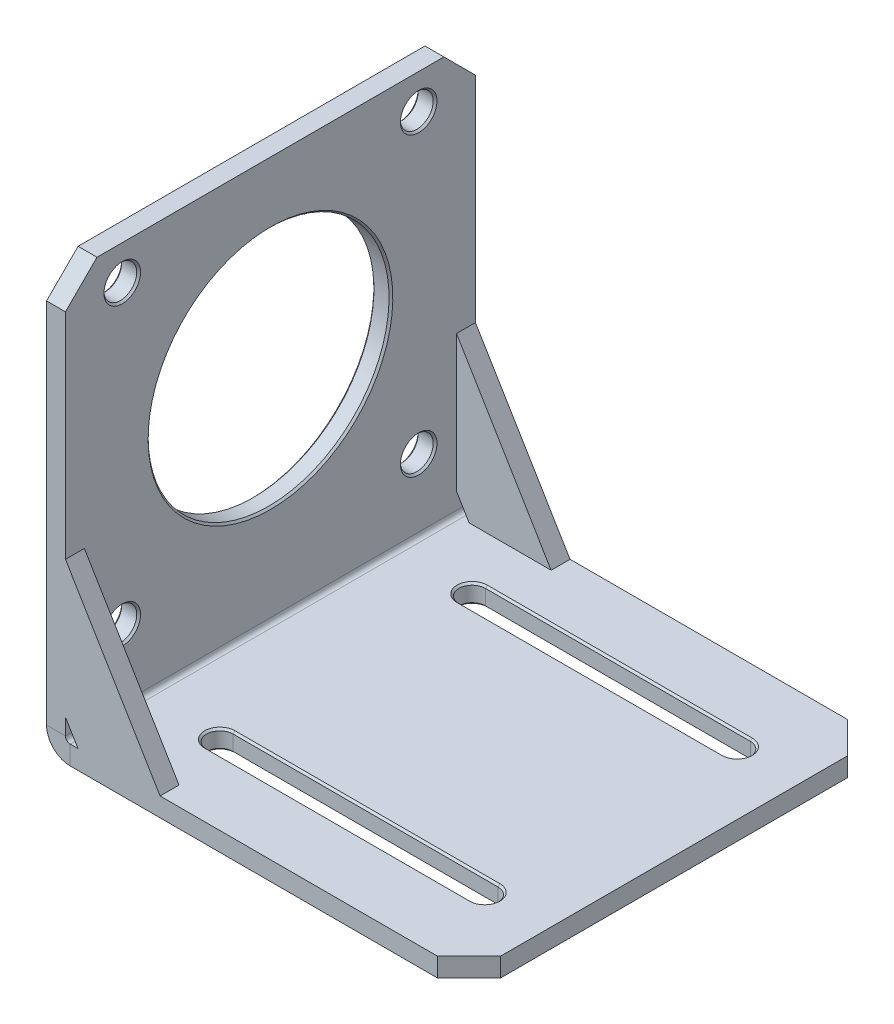
from build123d import *

# Parameters (mm, degrees)
SKETCH1_W                    = 130
SKETCH1_H                    = 65
BASE_FLANGE1_DEPTH           = 3
SKETCH2_R                    = 19.1
SKETCH2_R_2                  = 2.6
CUT_EXTRUDE1_DEPTH           = 135.034510481
CUT_EXTRUDE3_DEPTH           = 135.034510481
SKETCHED_BEND2_OUTLINE_W     = 3
SKETCHED_BEND2_OUTLINE_H     = 65
SKETCHED_BEND2_DEPTH         = 63.020021532
SKETCHED_START               = 63.383443248
SKETCHED_BEND2_2_OUTLINE_W   = 63.979978468
SKETCHED_BEND2_2_OUTLINE_H   = 65
SKETCHED_BEND2_2_OUTLINE_R   = 2.6
SKETCHED_BEND2_2_OUTLINE_R_2 = 19.1
SKETCHED_BEND2_2_DEPTH       = 2.636578284
SKETCHED_START_2             = 63.020021532
SKETCHED_BEND2_3_OUTLINE_W   = 63.979978468
SKETCHED_BEND2_3_OUTLINE_H   = 65
SKETCHED_BEND2_3_OUTLINE_R   = 2.6
SKETCHED_BEND2_3_OUTLINE_R_2 = 19.1
SKETCHED_BEND2_3_DEPTH       = 3.7366
SKETCHED_START_3             = -33
SKETCHED_BEND2_4_DEPTH       = 66
BOSS_EXTRUDE1_DEPTH          = 3
CHAMFER1_SIZE                = 5
CHAMFER2_SIZE                = 0.3


with BuildPart() as part:
    # Base-Flange1: sheet metal written as solids
    # Sketch1 → Base-Flange1 (new body)
    with BuildSketch(Plane(origin=(0, 0, 0), x_dir=(1, 0, 0), z_dir=(0, 1, 0))):
        with Locations((65, 0)):
            Rectangle(SKETCH1_W, SKETCH1_H)
    extrude(amount=-BASE_FLANGE1_DEPTH)

    # Sketch2 → Cut-Extrude1 (cut, through all)
    with BuildSketch(Plane(origin=(0, 0, 0), x_dir=(1, 0, 0), z_dir=(0, 1, 0))):
        with Locations(Location((29, 0, 0), (0, 0, 270))):
            Circle(SKETCH2_R)
        with Locations(Location((5.5, 23.5, 0), (0, 0, 270))):
            Circle(SKETCH2_R_2)
        with Locations(Location((52.5, 23.5, 0), (0, 0, 270))):
            Circle(SKETCH2_R_2)
        with Locations(Location((52.5, -23.5, 0), (0, 0, 270))):
            Circle(SKETCH2_R_2)
        with Locations(Location((5.5, -23.5, 0), (0, 0, 270))):
            Circle(SKETCH2_R_2)
    extrude(amount=-CUT_EXTRUDE1_DEPTH, mode=Mode.SUBTRACT)

    # Sketch4 → Cut-Extrude3 (cut, through all)
    with BuildSketch(Plane(origin=(0, 0, 0), x_dir=(1, 0, 0), z_dir=(0, 1, 0))):
        with BuildLine():
            Line((78, 22.1), (120, 22.1))
            ThreePointArc((120, 22.1), (122.1, 20), (120, 17.9))
            Line((120, 17.9), (78, 17.9))
            ThreePointArc((78, 17.9), (75.9, 20), (78, 22.1))
        make_face()
        with BuildLine():
            Line((78, -17.9), (120, -17.9))
            ThreePointArc((120, -17.9), (122.1, -20), (120, -22.1))
            Line((120, -22.1), (78, -22.1))
            ThreePointArc((78, -22.1), (75.9, -20), (78, -17.9))
        make_face()
    extrude(amount=-CUT_EXTRUDE3_DEPTH, mode=Mode.SUBTRACT)

    # Sketched Bend2: read off the stored shape, not the designer's step
    # Sketched Bend2 outline → Sketched Bend2 (cut)
    with BuildSketch(Plane.YZ):
        with Locations((-1.5, 0)):
            Rectangle(SKETCHED_BEND2_OUTLINE_W, SKETCHED_BEND2_OUTLINE_H)
    extrude(amount=SKETCHED_BEND2_DEPTH, mode=Mode.SUBTRACT)

    # Sketched Bend2 2 outline → Sketched Bend2 2 (add)
    with BuildSketch(Plane.YZ.offset(SKETCHED_START)):
        with Locations((31.989989234, 0)):
            Rectangle(SKETCHED_BEND2_2_OUTLINE_W, SKETCHED_BEND2_2_OUTLINE_H)
        with Locations((11.479978468, -23.5)):
            Circle(SKETCHED_BEND2_2_OUTLINE_R, mode=Mode.SUBTRACT)
        with Locations((58.479978468, -23.5)):
            Circle(SKETCHED_BEND2_2_OUTLINE_R, mode=Mode.SUBTRACT)
        with Locations((11.479978468, 23.5)):
            Circle(SKETCHED_BEND2_2_OUTLINE_R, mode=Mode.SUBTRACT)
        with Locations((34.979978468, 0)):
            Circle(SKETCHED_BEND2_2_OUTLINE_R_2, mode=Mode.SUBTRACT)
        with Locations((58.479978468, 23.5)):
            Circle(SKETCHED_BEND2_2_OUTLINE_R, mode=Mode.SUBTRACT)
    extrude(amount=SKETCHED_BEND2_2_DEPTH)

    # Sketched Bend2 3 outline → Sketched Bend2 3 (add)
    with BuildSketch(Plane.YZ.offset(SKETCHED_START_2)):
        with Locations((31.989989234, 0)):
            Rectangle(SKETCHED_BEND2_3_OUTLINE_W, SKETCHED_BEND2_3_OUTLINE_H)
        with Locations((11.479978468, -23.5)):
            Circle(SKETCHED_BEND2_3_OUTLINE_R, mode=Mode.SUBTRACT)
        with Locations((58.479978468, -23.5)):
            Circle(SKETCHED_BEND2_3_OUTLINE_R, mode=Mode.SUBTRACT)
        with Locations((11.479978468, 23.5)):
            Circle(SKETCHED_BEND2_3_OUTLINE_R, mode=Mode.SUBTRACT)
        with Locations((34.979978468, 0)):
            Circle(SKETCHED_BEND2_3_OUTLINE_R_2, mode=Mode.SUBTRACT)
        with Locations((58.479978468, 23.5)):
            Circle(SKETCHED_BEND2_3_OUTLINE_R, mode=Mode.SUBTRACT)
    extrude(amount=SKETCHED_BEND2_3_DEPTH)

    # Sketched Bend2 4 outline → Sketched Bend2 4 (cut)
    with BuildSketch(Plane.XY.offset(SKETCHED_START_3)):
        with BuildLine():
            Line((66.756621532, 63.979978468), (66.020021532, 63.979978468))
            Line((66.020021532, 63.979978468), (66.020021532, 0.7366))
            ThreePointArc((66.020021532, 0.7366), (66.235766677, 0.215745145), (66.756621532, 0))
            Line((66.756621532, 0), (66.756621532, 63.979978468))
        make_face()
        with BuildLine():
            ThreePointArc((66.756621532, -3), (64.114446333, -1.905575199), (63.020021532, 0.7366))
            Line((63.020021532, 0.7366), (63.020021532, -3))
            Line((63.020021532, -3), (66.756621532, -3))
        make_face()
    extrude(amount=SKETCHED_BEND2_4_DEPTH, mode=Mode.SUBTRACT)

    # Sketch6 → Boss-Extrude1 (add)
    with BuildSketch(Plane.XY.offset(32.5)):
        Polygon((66.020021532, 25), (81.020021532, 0), (68.020021532, 0), (66.020021532, 3.333333333), align=None)
    boss_extrude1 = extrude(amount=-BOSS_EXTRUDE1_DEPTH)

    # Mirror1: Boss-Extrude1 across plane
    add(boss_extrude1.mirror(Plane.XY))

    # Chamfer1
    chamfer1_edges = [part.edges().sort_by_distance(p)[0] for p in [
        (64.520021532, 63.979978468, -32.5),
        (64.520021532, 63.979978468, 32.5),
        (130, -1.5, -32.5),
        (130, -1.5, 32.5),
    ]]
    chamfer(chamfer1_edges, length=CHAMFER1_SIZE)

    # Chamfer2
    chamfer2_edges = [part.edges().sort_by_distance(p)[0] for p in [
        (63.020021532, 15.879978468, 0),
        (66.020021532, 15.879978468, 0),
        (63.020021532, 55.879978468, -23.5),
        (66.020021532, 55.879978468, -23.5),
        (63.020021532, 8.879978468, -23.5),
        (66.020021532, 8.879978468, -23.5),
        (63.020021532, 8.879978468, 23.5),
        (66.020021532, 8.879978468, 23.5),
        (63.020021532, 55.879978468, 23.5),
        (66.020021532, 55.879978468, 23.5),
        (99, 0, -22.1),
        (122.1, 0, -20),
        (99, 0, -17.9),
        (75.9, 0, -20),
        (99, 0, 17.9),
        (122.1, 0, 20),
        (99, 0, 22.1),
        (75.9, 0, 20),
        (75.9, -3, 20),
        (99, -3, 22.1),
        (122.1, -3, 20),
        (99, -3, 17.9),
        (75.9, -3, -20),
        (99, -3, -17.9),
        (122.1, -3, -20),
        (99, -3, -22.1),
    ]]
    chamfer(chamfer2_edges, length=CHAMFER2_SIZE)


solid = part.part
